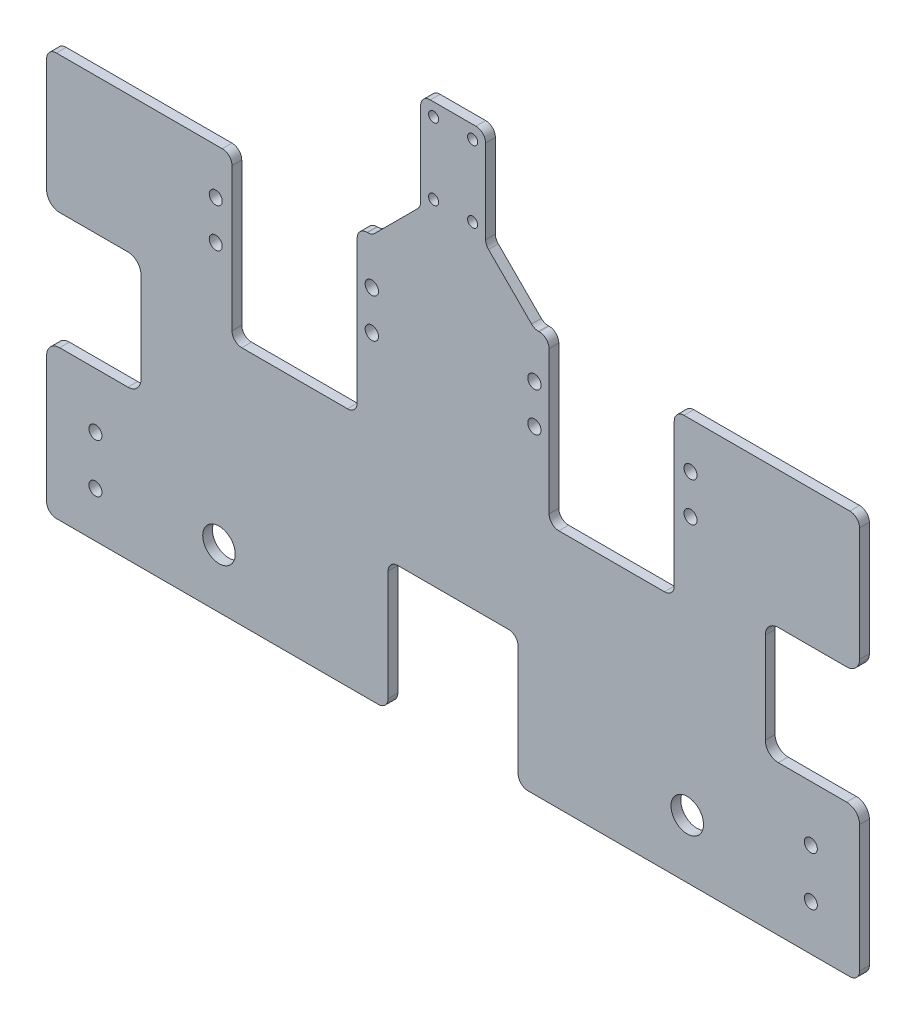
from build123d import *

# Parameters (mm, degrees)
EXTRUDE_1_DEPTH     = 3
SKETCH_2_R          = 1.55
CUT_EXTRUDE_1_DEPTH = 92.050809991
SKETCH_3_R          = 2.05
CUT_EXTRUDE_2_DEPTH = 92.050809991
SKETCH_4_W          = 3
SKETCH_4_H          = 40.476527492
CUT_EXTRUDE_3_DEPTH = 10
EXTRUDE_2_DEPTH     = 3
SKETCH_6_W          = 40
SKETCH_6_H          = 40
CUT_EXTRUDE_4_DEPTH = 4
FILLET_1_R          = 3
SKETCH_7_R          = 5
SKETCH_7_W          = 31
SKETCH_7_H          = 36
CUT_EXTRUDE_5_DEPTH = 4
SKETCH_8_R          = 2
CUT_EXTRUDE_6_DEPTH = 4
SKETCH_9_R          = 2
CUT_EXTRUDE_7_DEPTH = 4
FILLET_2_R          = 4


with BuildPart() as part:
    # 草图1 → 凸台-拉伸1 (new body)
    with BuildSketch(Plane.XY):
        Polygon((-32.5, 40), (-25, 40), (-10, 55), (-10, 85), (10, 85), (10, 55), (25, 40), (32.5, 40), (32.5, 0), (-32.5, 0), align=None)
    extrude(amount=EXTRUDE_1_DEPTH)

    # 草图2 → 切除-拉伸1 (cut, through all)
    with BuildSketch(Plane.XY.offset(3)):
        with Locations((-6, 81)):
            Circle(SKETCH_2_R)
        with Locations((-6, 59)):
            Circle(SKETCH_2_R)
        with Locations((6, 59)):
            Circle(SKETCH_2_R)
        with Locations((6, 81)):
            Circle(SKETCH_2_R)
    extrude(amount=-CUT_EXTRUDE_1_DEPTH, mode=Mode.SUBTRACT)

    # 草图3 → 切除-拉伸2 (cut, through all)
    with BuildSketch(Plane.XY.offset(3)):
        with Locations((-25, 26)):
            Circle(SKETCH_3_R)
        with Locations((-25, 14)):
            Circle(SKETCH_3_R)
        with Locations((25, 14)):
            Circle(SKETCH_3_R)
        with Locations((25, 26)):
            Circle(SKETCH_3_R)
    extrude(amount=-CUT_EXTRUDE_2_DEPTH, mode=Mode.SUBTRACT)

    # 草图4 → 切除-拉伸3 (cut)
    with BuildSketch(Plane.XY.offset(3)):
        with Locations((31, 19.761736254)):
            Rectangle(SKETCH_4_W, SKETCH_4_H)
        with Locations((-31, 19.761736254)):
            Rectangle(SKETCH_4_W, SKETCH_4_H)
    extrude(amount=-CUT_EXTRUDE_3_DEPTH, mode=Mode.SUBTRACT)

    # 草图5 → 凸台-拉伸2 (add)
    with BuildSketch(Plane.XY.offset(3)):
        Polygon((-125, 40), (-125, -84), (125, -84), (125, 40), (68, 40), (68, -10), (29.5, -10), (29.5, 0), (-29.5, 0), (-29.5, -10), (-68, -10), (-68, 40), align=None)
    extrude(amount=-EXTRUDE_2_DEPTH)

    # 草图6 → 切除-拉伸4 (cut)
    with BuildSketch(Plane.XY.offset(3)):
        with Locations((0, -64)):
            Rectangle(SKETCH_6_W, SKETCH_6_H)
    extrude(amount=-CUT_EXTRUDE_4_DEPTH, mode=Mode.SUBTRACT)

    # 圆角1
    fillet_1_edges = [part.edges().sort_by_distance(p)[0] for p in [
        (-20, -44, 1.5),
        (20, -44, 1.5),
        (20, -84, 1.5),
        (125, -84, 1.5),
        (68, 40, 1.5),
        (68, -10, 1.5),
        (29.5, -10, 1.5),
        (29.5, 40, 1.5),
        (25, 40, 1.5),
        (10, 55, 1.5),
        (10, 85, 1.5),
        (-10, 85, 1.5),
        (-10, 55, 1.5),
        (-25, 40, 1.5),
        (-29.5, 40, 1.5),
        (-29.5, -10, 1.5),
        (-68, -10, 1.5),
        (-68, 40, 1.5),
        (-125, 40, 1.5),
        (-125, -84, 1.5),
        (-20, -84, 1.5),
        (125, 40, 1.5),
    ]]
    fillet(fillet_1_edges, radius=FILLET_1_R)

    # 草图7 → 切除-拉伸5 (cut)
    with BuildSketch(Plane.XY.offset(3)):
        with Locations((72, -66)):
            Circle(SKETCH_7_R)
        with Locations((-72, -66)):
            Circle(SKETCH_7_R)
        with Locations((111.5, -20)):
            Rectangle(SKETCH_7_W, SKETCH_7_H)
        with Locations((-111.5, -20)):
            Rectangle(SKETCH_7_W, SKETCH_7_H)
    extrude(amount=-CUT_EXTRUDE_5_DEPTH, mode=Mode.SUBTRACT)

    # 草图8 → 切除-拉伸6 (cut)
    with BuildSketch(Plane.XY.offset(3)):
        with Locations((73, 26)):
            Circle(SKETCH_8_R)
        with Locations((73, 14)):
            Circle(SKETCH_8_R)
        with Locations((-73, 14)):
            Circle(SKETCH_8_R)
        with Locations((-73, 26)):
            Circle(SKETCH_8_R)
    extrude(amount=-CUT_EXTRUDE_6_DEPTH, mode=Mode.SUBTRACT)

    # 草图9 → 切除-拉伸7 (cut)
    with BuildSketch(Plane.XY.offset(3)):
        with Locations((110, -55)):
            Circle(SKETCH_9_R)
        with Locations((110, -70)):
            Circle(SKETCH_9_R)
        with Locations((-110, -70)):
            Circle(SKETCH_9_R)
        with Locations((-110, -55)):
            Circle(SKETCH_9_R)
    extrude(amount=-CUT_EXTRUDE_7_DEPTH, mode=Mode.SUBTRACT)

    # 圆角2
    fillet_2_edges = [part.edges().sort_by_distance(p)[0] for p in [
        (-96, -38, 1.5),
        (-125, -38, 1.5),
        (125, -38, 1.5),
        (96, -38, 1.5),
        (125, -2, 1.5),
        (-125, -2, 1.5),
        (-96, -2, 1.5),
        (96, -2, 1.5),
    ]]
    fillet(fillet_2_edges, radius=FILLET_2_R)


solid = part.part
